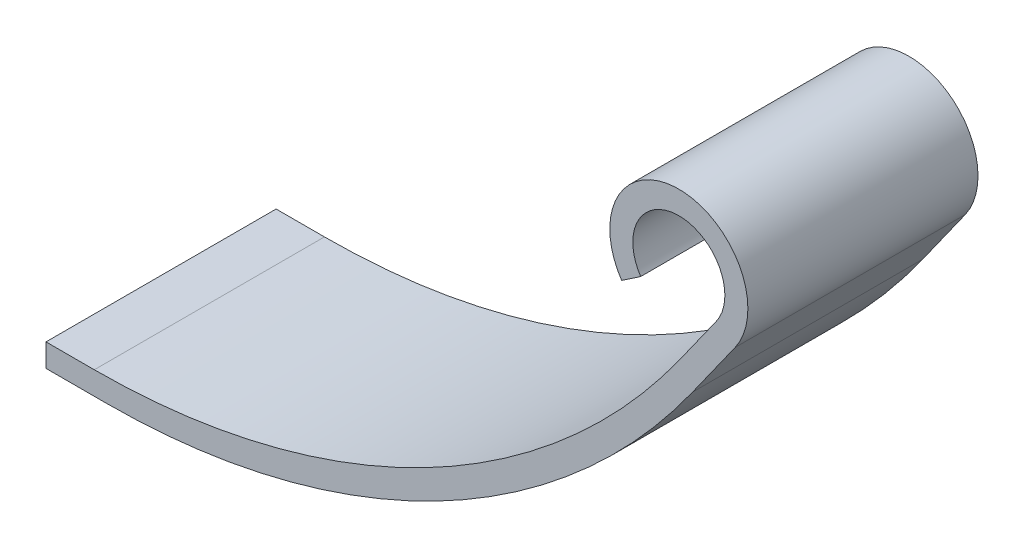
from build123d import *

# Parameters (mm, degrees)
BOSS_EXTRUDE1_DEPTH = 8
FILLET1_R           = 25


with BuildPart() as part:
    # Sketch1 → Boss-Extrude1 (new body)
    with BuildSketch(Plane.XY):
        with BuildLine():
            Line((0, 0), (15, 0))
            Line((15, 0), (23.956669948, 12.610236454))
            ThreePointArc((23.956669948, 12.610236454), (22.027601971, 16.399841272), (20.011882934, 12.655607746))
            Line((20.011882934, 12.655607746), (20.674588623, 13.103738497))
            ThreePointArc((20.674588623, 13.103738497), (22.018401314, 15.599894181), (23.304446632, 13.07349097))
            Line((23.304446632, 13.07349097), (14.586956827, 0.8))
            Line((14.586956827, 0.8), (0, 0.8))
            Line((0, 0.8), (0, 0))
        make_face()
    extrude(amount=BOSS_EXTRUDE1_DEPTH)

    # Fillet1
    fillet1_edges = [part.edges().sort_by_distance(p)[0] for p in [
        (15, 0, 4),
        (14.586956827, 0.8, 4),
    ]]
    fillet(fillet1_edges, radius=FILLET1_R)


solid = part.part
